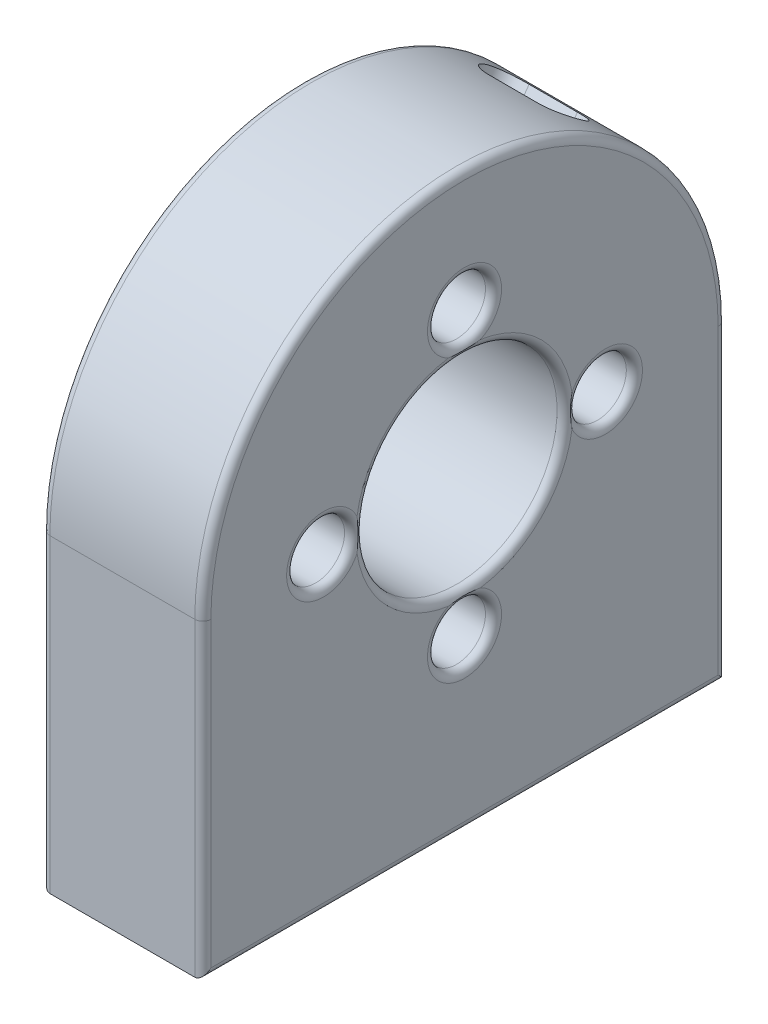
from build123d import *
from build123d.topology import SkipClean

# Parameters (mm, degrees)
SKIZZE1_W                       = 20
SKIZZE1_H                       = 65
AUFSATZ_LINEAR_AUSTRAGEN1_DEPTH = 71
SKIZZE2_R                       = 12.500000000000002
SKIZZE2_R_2                     = 2.099999999999994
SKIZZE2_R_3                     = 2.1000000000003562
SKIZZE2_R_4                     = 2.100000000000001
SKIZZE2_R_5                     = 2.1000000000000014
SCHNITT_LINEAR_AUSTRAGEN1_DEPTH = 81.60552090272725
SKIZZE3_R                       = 2.8
SCHNITT_LINEAR_AUSTRAGEN2_DEPTH = 15
SKIZZE6_R                       = 3.5999999999999996
SKIZZE6_R_2                     = 3.599999999999999
SKIZZE6_R_3                     = 3.5999999999999988
SKIZZE6_R_4                     = 3.5999999999999974
SCHNITT_LINEAR_AUSTRAGEN5_DEPTH = 11
CUT_EXTRUDE1_DEPTH              = 32.000000000000014
VERRUNDUNG1_R                   = 1


with BuildPart() as part:
    # Skizze1 → Aufsatz-Linear austragen1 (new body)
    with BuildSketch(Plane(origin=(0, 0, 0), x_dir=(1, 0, 0), z_dir=(0, 1, 0))):
        Rectangle(SKIZZE1_W, SKIZZE1_H)
    extrude(amount=AUFSATZ_LINEAR_AUSTRAGEN1_DEPTH)

    # Skizze2 → Schnitt-Linear austragen1 (cut, through all)
    with BuildSketch(Plane.ZY.offset(9.999999999999998)):
        with BuildLine():
            Line((-32.5, 71), (-32.5, 38.49999999999999))
            ThreePointArc((-32.50000000000001, 38.5), (-22.980970429075402, 61.48097034805019), (-1.1458695682e-07, 71))
            Line((-1.1458696036e-07, 71), (-32.5, 71))
        make_face()
        with BuildLine():
            ThreePointArc((-1.1458695682e-07, 71), (22.980970348050192, 61.4809704290754), (32.50000000000001, 38.49999999999999))
            Line((32.5, 38.5), (32.5, 71))
            Line((32.5, 71), (-1.1458696036e-07, 71))
        make_face()
        with Locations((0, 38.49999999999999)):
            Circle(SKIZZE2_R)
        with Locations((17.500000000000007, 38.499999999999986)):
            Circle(SKIZZE2_R_2)
        with Locations((-3.5727e-13, 56)):
            Circle(SKIZZE2_R_3)
        with Locations((1.266e-14, 20.999999999999964)):
            Circle(SKIZZE2_R_4)
        with Locations((-17.500000000000007, 38.499999999999964)):
            Circle(SKIZZE2_R_5)
    extrude(amount=-SCHNITT_LINEAR_AUSTRAGEN1_DEPTH, mode=Mode.SUBTRACT)

    # Skizze3 → Schnitt-Linear austragen2 (cut)
    with BuildSketch(Plane.XZ):
        with Locations(Location((0, 22.5, 0), (0, 0, 270))):
            Circle(SKIZZE3_R)
        with Locations(Location((0, 9.999999999999998, 0), (0, 0, 270))):
            Circle(SKIZZE3_R)
        with Locations(Location((0, -9.999999999999998, 0), (0, 0, 90))):
            Circle(SKIZZE3_R)
        with Locations(Location((0, -22.5, 0), (0, 0, 90))):
            Circle(SKIZZE3_R)
    extrude(amount=-SCHNITT_LINEAR_AUSTRAGEN2_DEPTH, mode=Mode.SUBTRACT)

    # Skizze6 → Schnitt-Linear austragen5 (cut)
    with BuildSketch(Plane(origin=(10.000000000000002, 0, 0), x_dir=(0, 0, -1), z_dir=(1, 0, 0))):
        with Locations((-1.388e-14, 20.999999999999964)):
            Circle(SKIZZE6_R)
        with Locations((-17.50000000000003, 38.5)):
            Circle(SKIZZE6_R_2)
        with Locations((1.173e-14, 56.00000000000002)):
            Circle(SKIZZE6_R_3)
        with Locations((17.50000000000003, 38.49999999999998)):
            Circle(SKIZZE6_R_4)
    extrude(amount=-SCHNITT_LINEAR_AUSTRAGEN5_DEPTH, mode=Mode.SUBTRACT)

    # Sketch1 → Cut-Extrude1 (cut)
    with SkipClean():  # the faces are left unmerged after this step: merging them gives an invalid solid
        with BuildSketch(Plane(origin=(0, 52.4563291984119, -36.730317131537376), x_dir=(-1, 0, 0), z_dir=(0, 0.8191520442889972, -0.5735764363510384))):
            with BuildLine():
                Line((-3, 25.082692799514973), (3, 25.082692799514973))
                ThreePointArc((3, 25.082692799514973), (6, 22.082692799514973), (3, 19.082692799514973))
                Line((3, 19.082692799514973), (-3, 19.082692799514973))
                ThreePointArc((-3, 19.082692799514973), (-6, 22.082692799514973), (-3, 25.082692799514973))
            make_face()
        extrude(amount=-CUT_EXTRUDE1_DEPTH, mode=Mode.SUBTRACT)

    # Verrundung1
    # the kernel refuses this fillet: 1 mm, written as the material it takes off along each edge
    with BuildSketch(Plane(origin=(10.000000000000002, -2.4999999999999996, 32.5), x_dir=(-1, 0, 0), z_dir=(0, 1, 0))) as verrundung1_piece_1:
        with BuildLine():
            CenterArc((VERRUNDUNG1_R, -VERRUNDUNG1_R), VERRUNDUNG1_R, 90, 90)
            Line((0, -VERRUNDUNG1_R), (0, 0))
            Line((0, 0), (VERRUNDUNG1_R, 0))
        make_face()
    extrude(amount=41, mode=Mode.SUBTRACT)
    with BuildSketch(Plane(origin=(-9.999999999999998, -2.4999999999999996, 32.5), x_dir=(1, 0, 0), z_dir=(0, 1, 0))) as verrundung1_piece_2:
        with BuildLine():
            CenterArc((VERRUNDUNG1_R, VERRUNDUNG1_R), VERRUNDUNG1_R, 180, 90)
            Line((0, VERRUNDUNG1_R), (0, 0))
            Line((0, 0), (VERRUNDUNG1_R, 0))
        make_face()
    extrude(amount=41, mode=Mode.SUBTRACT)
    with BuildSketch(Plane(origin=(-9.999999999999998, 38.499999999999986, 1.78e-15), x_dir=(0, 4.4e-16, -1), z_dir=(0, -1, -4.4e-16))) as verrundung1_piece_3:
        with BuildLine():
            CenterArc((32.500000000000014 - VERRUNDUNG1_R, VERRUNDUNG1_R), VERRUNDUNG1_R, 269.99999999999875, 90.00000000000125)
            Line((32.500000000000014 - VERRUNDUNG1_R, 0), (32.500000000000014, 0))
            Line((32.500000000000014, 0), (32.500000000000036, VERRUNDUNG1_R))
        make_face()
    revolve(axis=Axis((-9.999999999999998, 38.499999999999986, 1.78e-15), (1, 0, 0)), revolution_arc=179.99999999999994, mode=Mode.SUBTRACT)
    with BuildSketch(Plane(origin=(10.000000000000002, 38.499999999999986, 1.78e-15), x_dir=(0, 4.4e-16, -1), z_dir=(0, -1, -4.4e-16))) as verrundung1_piece_4:
        with BuildLine():
            CenterArc((32.500000000000014 - VERRUNDUNG1_R, -VERRUNDUNG1_R), VERRUNDUNG1_R, 0, 90)
            Line((32.500000000000014, -VERRUNDUNG1_R), (32.500000000000014, 0))
            Line((32.500000000000014, 0), (32.500000000000014 - VERRUNDUNG1_R, 0))
        make_face()
    revolve(axis=Axis((10.000000000000002, 38.499999999999986, 1.78e-15), (1, 0, 0)), revolution_arc=179.99999999999994, mode=Mode.SUBTRACT)
    with BuildSketch(Plane(origin=(-9.999999999999998, -2.4999999999999996, -32.5), x_dir=(0, 0, 1), z_dir=(0, 1, 0))) as verrundung1_piece_5:
        with BuildLine():
            CenterArc((VERRUNDUNG1_R, VERRUNDUNG1_R), VERRUNDUNG1_R, 180, 90)
            Line((0, VERRUNDUNG1_R), (0, 0))
            Line((0, 0), (VERRUNDUNG1_R, 0))
        make_face()
    extrude(amount=41, mode=Mode.SUBTRACT)
    with BuildSketch(Plane(origin=(10.000000000000002, -2.4999999999999996, -32.5), x_dir=(0, 0, 1), z_dir=(0, 1, 0))) as verrundung1_piece_6:
        with BuildLine():
            CenterArc((VERRUNDUNG1_R, -VERRUNDUNG1_R), VERRUNDUNG1_R, 90, 90)
            Line((0, -VERRUNDUNG1_R), (0, 0))
            Line((0, 0), (VERRUNDUNG1_R, 0))
        make_face()
    extrude(amount=41, mode=Mode.SUBTRACT)
    with BuildSketch(Plane(origin=(10.000000000000002, 38.49999999999999, 0), x_dir=(0, 0, 1), z_dir=(0, -1, 0))) as verrundung1_piece_7:
        with BuildLine():
            CenterArc((12.500000000000002 + VERRUNDUNG1_R, VERRUNDUNG1_R), VERRUNDUNG1_R, 180, 90)
            Line((12.5, VERRUNDUNG1_R), (12.500000000000002, 0))
            Line((12.500000000000002, 0), (12.500000000000002 + VERRUNDUNG1_R, 0))
        make_face()
    revolve(axis=Axis((10.000000000000002, 38.49999999999999, 0), (-1, 0, 0)), mode=Mode.SUBTRACT)
    with BuildSketch(Plane(origin=(-9.999999999999998, 38.49999999999999, 0), x_dir=(0, 0, 1), z_dir=(0, -1, 0))) as verrundung1_piece_8:
        with BuildLine():
            CenterArc((12.500000000000002 + VERRUNDUNG1_R, -VERRUNDUNG1_R), VERRUNDUNG1_R, 90, 90)
            Line((12.5, -VERRUNDUNG1_R), (12.500000000000002, 0))
            Line((12.500000000000002, 0), (12.500000000000002 + VERRUNDUNG1_R, 0))
        make_face()
    revolve(axis=Axis((-9.999999999999998, 38.49999999999999, 0), (-1, 0, 0)), mode=Mode.SUBTRACT)
    with BuildSketch(Plane(origin=(-9.999999999999998, 20.999999999999964, 1.266e-14), x_dir=(0, 0, 1), z_dir=(0, -1, 0))) as verrundung1_piece_9:
        with BuildLine():
            CenterArc((2.1000000000000014 + VERRUNDUNG1_R, -VERRUNDUNG1_R), VERRUNDUNG1_R, 90, 90)
            Line((2.100000000000003, -VERRUNDUNG1_R), (2.1000000000000014, 0))
            Line((2.1000000000000014, 0), (2.1000000000000014 + VERRUNDUNG1_R, 0))
        make_face()
    revolve(axis=Axis((-9.999999999999998, 20.999999999999964, 1.266e-14), (-1, 0, 0)), mode=Mode.SUBTRACT)
    with BuildSketch(Plane(origin=(-9.999999999999998, 56, -3.5727e-13), x_dir=(0, 0, 1), z_dir=(0, -1, 0))) as verrundung1_piece_10:
        with BuildLine():
            CenterArc((2.100000000000356 + VERRUNDUNG1_R, -VERRUNDUNG1_R), VERRUNDUNG1_R, 90, 90)
            Line((2.1000000000003585, -VERRUNDUNG1_R), (2.100000000000356, 0))
            Line((2.100000000000356, 0), (2.100000000000356 + VERRUNDUNG1_R, 0))
        make_face()
    revolve(axis=Axis((-9.999999999999998, 56, -3.5727e-13), (-1, 0, 0)), mode=Mode.SUBTRACT)
    with BuildSketch(Plane(origin=(-9.999999999999998, 38.499999999999964, -17.500000000000007), x_dir=(0, 0, 1), z_dir=(0, -1, 0))) as verrundung1_piece_11:
        with BuildLine():
            CenterArc((2.1000000000000014 + VERRUNDUNG1_R, -VERRUNDUNG1_R), VERRUNDUNG1_R, 90, 90)
            Line((2.1000000000000014, -VERRUNDUNG1_R), (2.1000000000000014, 0))
            Line((2.1000000000000014, 0), (2.1000000000000014 + VERRUNDUNG1_R, 0))
        make_face()
    revolve(axis=Axis((-9.999999999999998, 38.499999999999964, -17.500000000000007), (-1, 0, 0)), mode=Mode.SUBTRACT)
    with BuildSketch(Plane(origin=(-9.999999999999998, 38.499999999999986, 17.500000000000007), x_dir=(0, 0, 1), z_dir=(0, -1, 0))) as verrundung1_piece_12:
        with BuildLine():
            CenterArc((2.0999999999999943 + VERRUNDUNG1_R, -VERRUNDUNG1_R), VERRUNDUNG1_R, 90, 90)
            Line((2.0999999999999943, -VERRUNDUNG1_R), (2.0999999999999943, 0))
            Line((2.0999999999999943, 0), (2.0999999999999943 + VERRUNDUNG1_R, 0))
        make_face()
    revolve(axis=Axis((-9.999999999999998, 38.499999999999986, 17.500000000000007), (-1, 0, 0)), mode=Mode.SUBTRACT)
    with BuildSketch(Plane(origin=(-9.999999999999998, 0, -35), x_dir=(1, 0, 0), z_dir=(0, 0, 1)), Plane(origin=(10.000000000000002, 0, 35), x_dir=(-1, 0, 0), z_dir=(0, 0, -1))) as verrundung1_piece_13:
        with BuildLine():
            CenterArc((VERRUNDUNG1_R, VERRUNDUNG1_R), VERRUNDUNG1_R, 180, 90)
            Line((0, VERRUNDUNG1_R), (0, 0))
            Line((0, 0), (VERRUNDUNG1_R, 0))
        make_face()
    extrude(amount=70, mode=Mode.SUBTRACT)
    with BuildSketch(Plane(origin=(0, 0, 22.5), x_dir=(-1.8e-16, 0, -1), z_dir=(-1, 0, 1.8e-16))) as verrundung1_piece_14:
        with BuildLine():
            CenterArc((2.8000000000000007 + VERRUNDUNG1_R, -VERRUNDUNG1_R), VERRUNDUNG1_R, 90, 90)
            Line((2.8000000000000007, -VERRUNDUNG1_R), (2.8000000000000007, 0))
            Line((2.8000000000000007, 0), (2.8000000000000007 + VERRUNDUNG1_R, 0))
        make_face()
    revolve(axis=Axis((0, 0, 22.5), (0, -1, 0)), mode=Mode.SUBTRACT)
    with BuildSketch(Plane(origin=(0, 0, 9.999999999999998), x_dir=(-1.8e-16, 0, -1), z_dir=(-1, 0, 1.8e-16))) as verrundung1_piece_15:
        with BuildLine():
            CenterArc((2.8 + VERRUNDUNG1_R, -VERRUNDUNG1_R), VERRUNDUNG1_R, 90, 90)
            Line((2.8, -VERRUNDUNG1_R), (2.8, 0))
            Line((2.8, 0), (2.8 + VERRUNDUNG1_R, 0))
        make_face()
    revolve(axis=Axis((0, 0, 9.999999999999998), (0, -1, 0)), mode=Mode.SUBTRACT)
    with BuildSketch(Plane(origin=(0, 0, -9.999999999999998), x_dir=(6e-17, 0, 1), z_dir=(1, 0, -6e-17))) as verrundung1_piece_16:
        with BuildLine():
            CenterArc((2.8 + VERRUNDUNG1_R, -VERRUNDUNG1_R), VERRUNDUNG1_R, 90, 90)
            Line((2.8, -VERRUNDUNG1_R), (2.8, 0))
            Line((2.8, 0), (2.8 + VERRUNDUNG1_R, 0))
        make_face()
    revolve(axis=Axis((0, 0, -9.999999999999998), (0, -1, 0)), mode=Mode.SUBTRACT)
    with BuildSketch(Plane(origin=(0, 0, -22.5), x_dir=(6e-17, 0, 1), z_dir=(1, 0, -6e-17))) as verrundung1_piece_17:
        with BuildLine():
            CenterArc((2.8000000000000007 + VERRUNDUNG1_R, -VERRUNDUNG1_R), VERRUNDUNG1_R, 90, 90)
            Line((2.8000000000000007, -VERRUNDUNG1_R), (2.8000000000000007, 0))
            Line((2.8000000000000007, 0), (2.8000000000000007 + VERRUNDUNG1_R, 0))
        make_face()
    revolve(axis=Axis((0, 0, -22.5), (0, -1, 0)), mode=Mode.SUBTRACT)
    with BuildSketch(Plane(origin=(10.000000000000002, 38.5, 17.50000000000003), x_dir=(0, 0, -1), z_dir=(0, -1, 0))) as verrundung1_piece_18:
        with BuildLine():
            CenterArc((3.5999999999999996 + VERRUNDUNG1_R, -VERRUNDUNG1_R), VERRUNDUNG1_R, 90, 90)
            Line((3.6000000000000014, -VERRUNDUNG1_R), (3.5999999999999996, 0))
            Line((3.5999999999999996, 0), (3.5999999999999996 + VERRUNDUNG1_R, 0))
        make_face()
    revolve(axis=Axis((10.000000000000002, 38.5, 17.50000000000003), (1, 0, 0)), mode=Mode.SUBTRACT)
    with BuildSketch(Plane(origin=(10.000000000000002, 56.00000000000002, -1.173e-14), x_dir=(0, 0, -1), z_dir=(0, -1, 0))) as verrundung1_piece_19:
        with BuildLine():
            CenterArc((3.5999999999999988 + VERRUNDUNG1_R, -VERRUNDUNG1_R), VERRUNDUNG1_R, 90, 90)
            Line((3.599999999999997, -VERRUNDUNG1_R), (3.5999999999999988, 0))
            Line((3.5999999999999988, 0), (3.5999999999999988 + VERRUNDUNG1_R, 0))
        make_face()
    revolve(axis=Axis((10.000000000000002, 56.00000000000002, -1.173e-14), (1, 0, 0)), mode=Mode.SUBTRACT)
    with BuildSketch(Plane(origin=(10.000000000000002, 38.49999999999998, -17.50000000000003), x_dir=(0, 0, -1), z_dir=(0, -1, 0))) as verrundung1_piece_20:
        with BuildLine():
            CenterArc((3.599999999999998 + VERRUNDUNG1_R, -VERRUNDUNG1_R), VERRUNDUNG1_R, 90, 90)
            Line((3.5999999999999943, -VERRUNDUNG1_R), (3.599999999999998, 0))
            Line((3.599999999999998, 0), (3.599999999999998 + VERRUNDUNG1_R, 0))
        make_face()
    revolve(axis=Axis((10.000000000000002, 38.49999999999998, -17.50000000000003), (1, 0, 0)), mode=Mode.SUBTRACT)
    with BuildSketch(Plane(origin=(10.000000000000002, 20.999999999999964, 1.388e-14), x_dir=(0, 0, -1), z_dir=(0, -1, 0))) as verrundung1_piece_21:
        with BuildLine():
            CenterArc((3.5999999999999996 + VERRUNDUNG1_R, -VERRUNDUNG1_R), VERRUNDUNG1_R, 90, 90)
            Line((3.600000000000001, -VERRUNDUNG1_R), (3.5999999999999996, 0))
            Line((3.5999999999999996, 0), (3.5999999999999996 + VERRUNDUNG1_R, 0))
        make_face()
    revolve(axis=Axis((10.000000000000002, 20.999999999999964, 1.388e-14), (1, 0, 0)), mode=Mode.SUBTRACT)


solid = part.part
